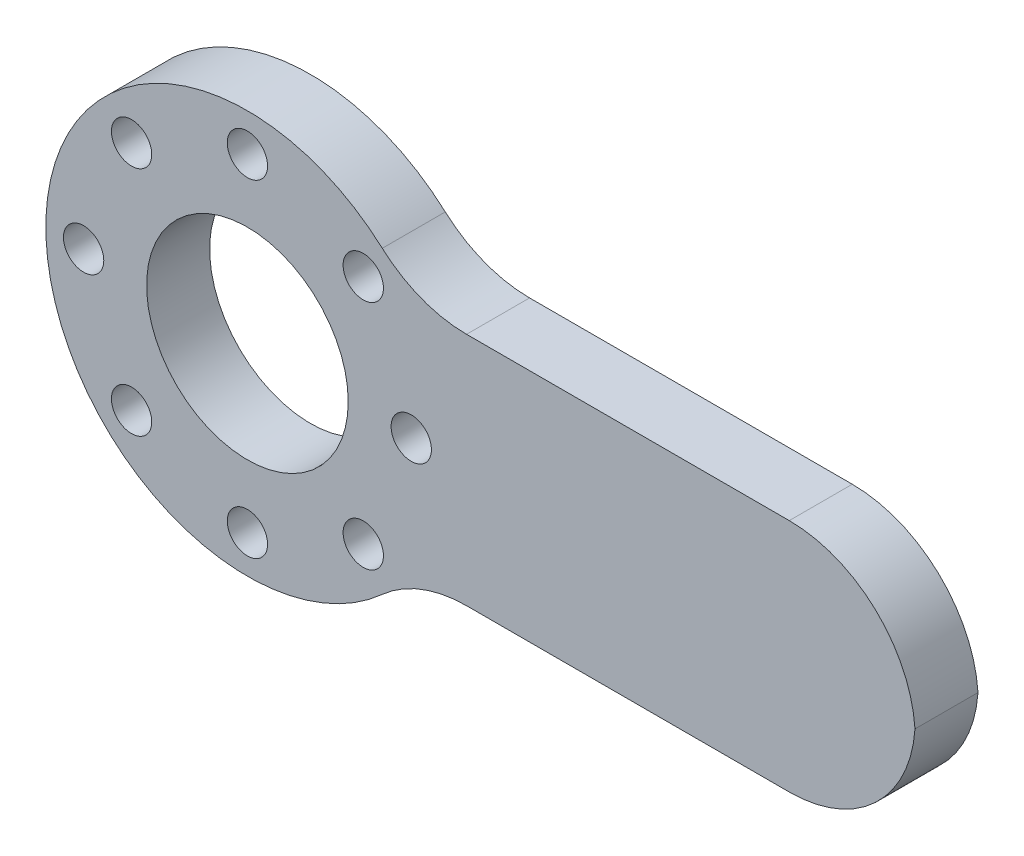
from build123d import *

# Parameters (mm, degrees)
SKETCH1_R           = 1.6
SKETCH1_R_2         = 8
BOSS_EXTRUDE1_DEPTH = 5
FILLET1_R           = 10
FILLET2_R           = 10


with BuildPart() as part:
    # Sketch1 → Boss-Extrude1 (new body)
    with BuildSketch(Plane.XY):
        with BuildLine():
            Line((13, 9.327379053), (53, 9.327379053))
            Line((53, 9.327379053), (53, -9.327379053))
            Line((53, -9.327379053), (13, -9.327379053))
            ThreePointArc((13, -9.327379053), (-16, 0), (13, 9.327379053))
        make_face()
        with Locations((0, 13)):
            Circle(SKETCH1_R, mode=Mode.SUBTRACT)
        with Locations((9.192388155, 9.192388155)):
            Circle(SKETCH1_R, mode=Mode.SUBTRACT)
        with Locations((13, 0)):
            Circle(SKETCH1_R, mode=Mode.SUBTRACT)
        with Locations((9.192388155, -9.192388155)):
            Circle(SKETCH1_R, mode=Mode.SUBTRACT)
        with Locations((0, -13)):
            Circle(SKETCH1_R, mode=Mode.SUBTRACT)
        with Locations((-9.192388155, -9.192388155)):
            Circle(SKETCH1_R, mode=Mode.SUBTRACT)
        with Locations((-13, 0)):
            Circle(SKETCH1_R, mode=Mode.SUBTRACT)
        with Locations((-9.192388155, 9.192388155)):
            Circle(SKETCH1_R, mode=Mode.SUBTRACT)
        Circle(SKETCH1_R_2, mode=Mode.SUBTRACT)
    extrude(amount=BOSS_EXTRUDE1_DEPTH)

    # Fillet1
    # the kernel refuses this fillet: 10 mm, written as the material it takes off along each edge
    with BuildSketch(Plane(origin=(53, -9.327379053, -25), x_dir=(0, 1, 0), z_dir=(0, 0, 1)), Plane(origin=(53, 9.327379053, -25), x_dir=(-1, 0, 0), z_dir=(0, 0, 1))) as fillet1_piece_1:
        with BuildLine():
            CenterArc((FILLET1_R, FILLET1_R), FILLET1_R, 180, 90)
            Line((0, FILLET1_R), (0, 0))
            Line((0, 0), (FILLET1_R, 0))
        make_face()
    extrude(amount=55, mode=Mode.SUBTRACT)

    # Fillet2
    fillet2_edges = [part.edges().sort_by_distance(p)[0] for p in [
        (13, 9.327379053, 2.5),
        (13, -9.327379053, 2.5),
    ]]
    fillet(fillet2_edges, radius=FILLET2_R)


solid = part.part
